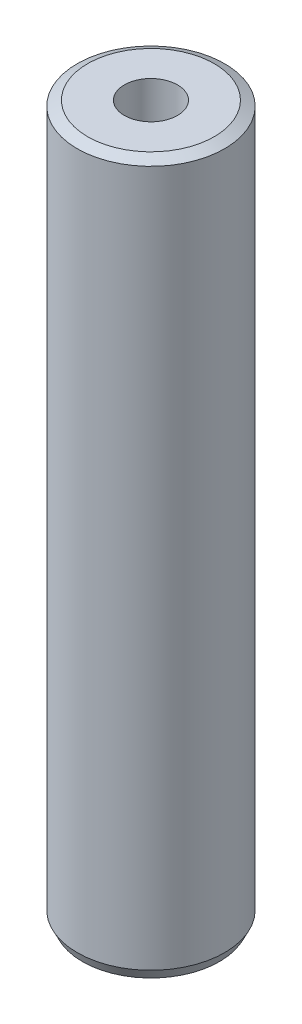
from build123d import *
from OCP.BRepFilletAPI import BRepFilletAPI_MakeChamfer

# Parameters (mm, degrees)
SKETCH1_R           = 57.5
BOSS_EXTRUDE1_DEPTH = 555.310233263
SKETCH2_R           = 20.720301802
CUT_EXTRUDE1_DEPTH  = 562.232532171
CHAMFER1_SIZE       = 4.058975016
CHAMFER1_SIZE2      = 8.107214109


with BuildPart() as part:
    # Sketch1 → Boss-Extrude1 (new body)
    with BuildSketch(Plane(origin=(0, 0, 0), x_dir=(1, 0, 0), z_dir=(0, 1, 0))):
        Circle(SKETCH1_R)
    extrude(amount=BOSS_EXTRUDE1_DEPTH)

    # Sketch2 → Cut-Extrude1 (cut, through all)
    with BuildSketch(Plane(origin=(0, 0, 0), x_dir=(1, 0, 0), z_dir=(0, 1, 0))):
        Circle(SKETCH2_R)
    extrude(amount=CUT_EXTRUDE1_DEPTH, mode=Mode.SUBTRACT)

    # Chamfer1: one chamfer whose edges measure the first distance from different faces: ONE call of the kernel's chamfer builder (chamfer() names one face for all edges)
    chamfer1_edges_1 = [part.edges().sort_by_distance(p)[0] for p in [
        (-57.5, 555.310233263, 0),
    ]]
    chamfer1_side_1 = [part.faces().sort_by_distance(p)[0] for p in [
        (-57.5, 277.655116632, 0),
    ]]
    chamfer1_edges_2 = [part.edges().sort_by_distance(p)[0] for p in [
        (-57.5, 0, 0),
    ]]
    chamfer1_side_2 = [part.faces().sort_by_distance(p)[0] for p in [
        (-55.873654403, 0, 0),
    ]]
    chamfer1 = BRepFilletAPI_MakeChamfer(part.part.solid().wrapped)
    for e in chamfer1_edges_1:
        chamfer1.Add(CHAMFER1_SIZE, CHAMFER1_SIZE2, e.wrapped, chamfer1_side_1[0].wrapped)  # the first distance lies on this face
    for e in chamfer1_edges_2:
        chamfer1.Add(CHAMFER1_SIZE, CHAMFER1_SIZE2, e.wrapped, chamfer1_side_2[0].wrapped)  # the first distance lies on this face
    add(Compound.cast(chamfer1.Shape()), mode=Mode.REPLACE)


solid = part.part
